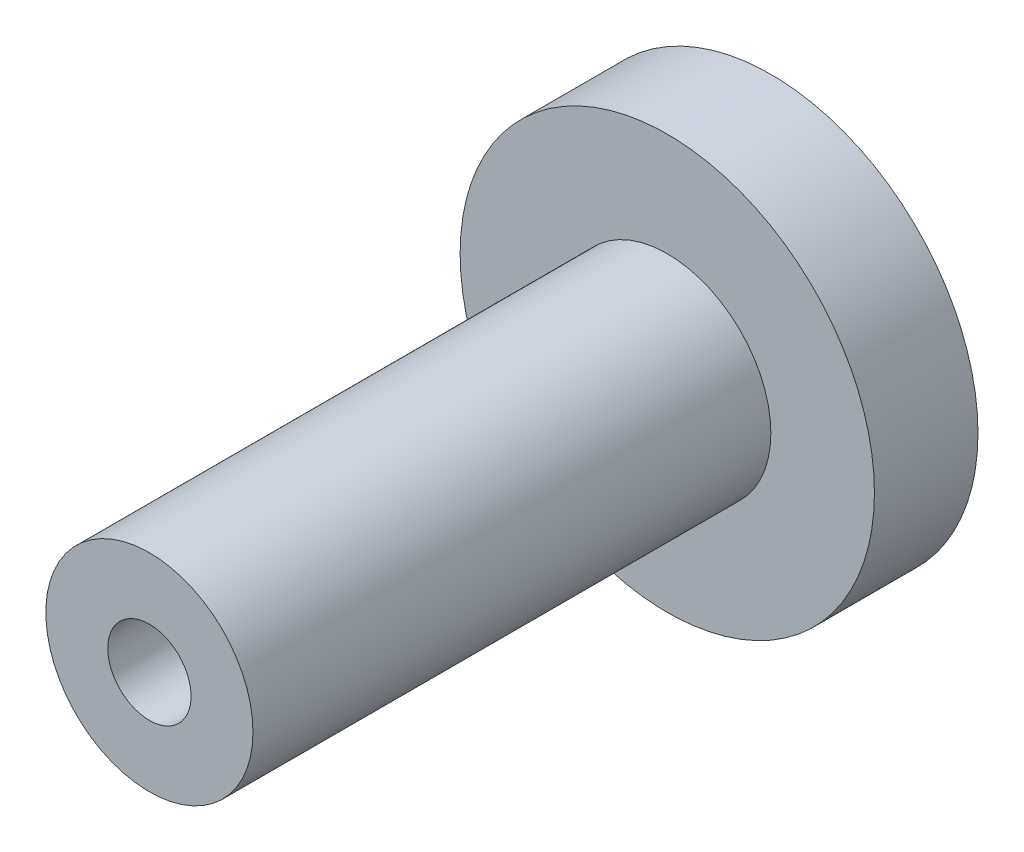
from build123d import *

# Parameters (mm, degrees)
SKETCH1_R           = 12.7
SKETCH1_R_2         = 2.555
BOSS_EXTRUDE1_DEPTH = 38.1
CUT_EXTRUDE1_START  = -31.75
SKETCH2_R           = 12.7
SKETCH2_R_2         = 6.35
CUT_EXTRUDE1_DEPTH  = 31.75


with BuildPart() as part:
    # Sketch1 → Boss-Extrude1 (new body)
    with BuildSketch(Plane.XY):
        Circle(SKETCH1_R)
        Circle(SKETCH1_R_2, mode=Mode.SUBTRACT)
    extrude(amount=BOSS_EXTRUDE1_DEPTH)

    # Sketch2 → Cut-Extrude1 (cut)
    with BuildSketch(Plane.XY.offset(38.1).offset(CUT_EXTRUDE1_START)):
        Circle(SKETCH2_R)
        Circle(SKETCH2_R_2, mode=Mode.SUBTRACT)
    extrude(amount=CUT_EXTRUDE1_DEPTH, mode=Mode.SUBTRACT)


solid = part.part
